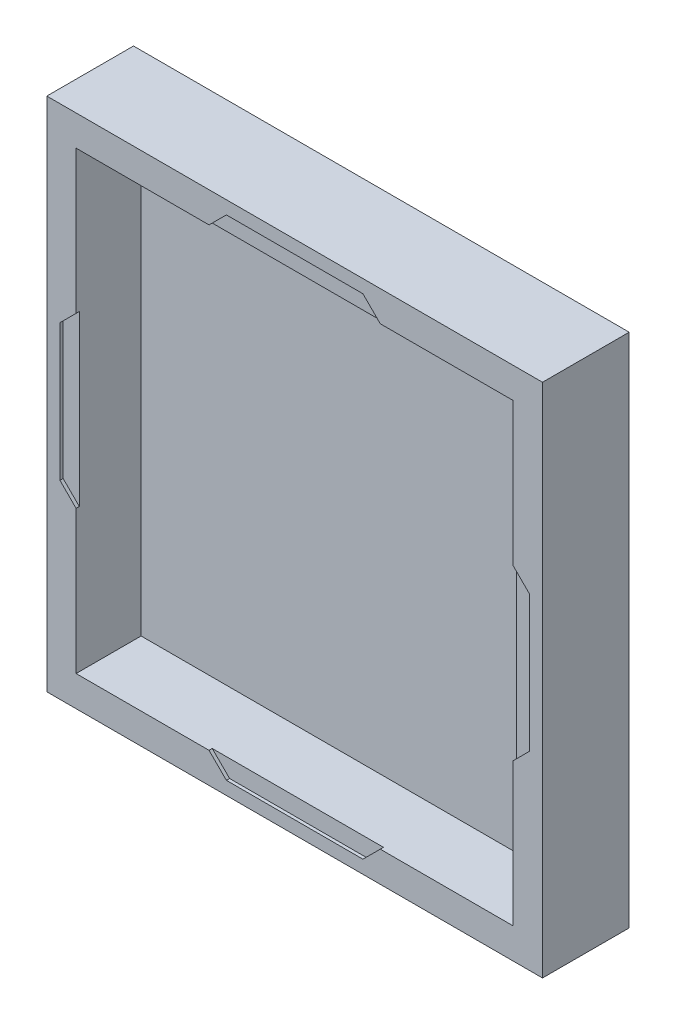
from build123d import *

# Parameters (mm, degrees)
SKETCH1_W           = 120.9294
SKETCH1_H           = 116.1796
BOSS_EXTRUDE1_DEPTH = 5.08
SKETCH2_W           = 116.1796
SKETCH2_H           = 120.9294
SKETCH2_W_2         = 102.459137156
SKETCH2_H_2         = 106.648
BOSS_EXTRUDE2_DEPTH = 15.24
CUT_EXTRUDE1_DEPTH  = 0.75


with BuildPart() as part:
    # Sketch1 → Boss-Extrude1 (new body)
    with BuildSketch(Plane(origin=(0, 0, 0), x_dir=(0, 1, 0), z_dir=(0, 0, 1))):
        Rectangle(SKETCH1_W, SKETCH1_H)
    extrude(amount=BOSS_EXTRUDE1_DEPTH)

    # Sketch2 → Boss-Extrude2 (add)
    with BuildSketch(Plane.XY.offset(5.08)):
        Rectangle(SKETCH2_W, SKETCH2_H)
        Rectangle(SKETCH2_W_2, SKETCH2_H_2, mode=Mode.SUBTRACT)
    extrude(amount=BOSS_EXTRUDE2_DEPTH)

    # Sketch3 → Cut-Extrude1 (cut)
    with BuildSketch(Plane.XY.offset(20.32)):
        Polygon((-50.0126, -52.3875), (-21, -52.3875), (-16, -57.3875), (16, -57.3875), (21, -52.3875), (50.0126, -52.3875), (50.0126, -21), (55.0126, -16), (55.0126, 16), (50.0126, 21), (50.0126, 52.3875), (21, 52.3875), (16, 57.3875), (-16, 57.3875), (-21, 52.3875), (-50.0126, 52.3875), (-50.0126, 21), (-55.0126, 16), (-55.0126, -16), (-50.0126, -21), align=None)
    extrude(amount=-CUT_EXTRUDE1_DEPTH, mode=Mode.SUBTRACT)


solid = part.part
